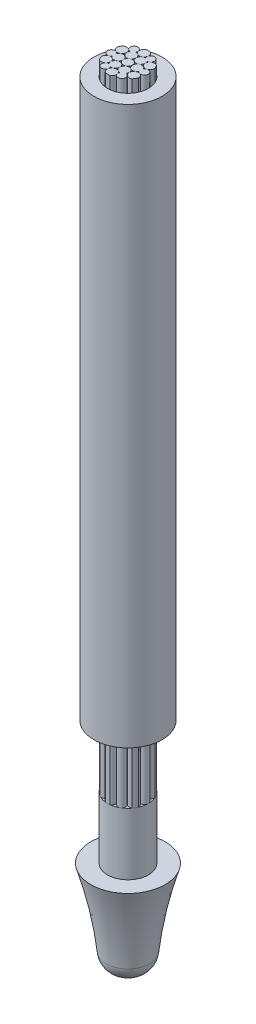
from build123d import *

# Parameters (mm, degrees)
EXTRUDE_2_OUTLINE_R = 0.075
EXTRUDE_2_DEPTH     = 10.2
EXTRUDE_2_2_DEPTH   = 10.2
EXTRUDE_2_3_DEPTH   = 10.2
EXTRUDE_2_4_DEPTH   = 10.2
EXTRUDE_2_5_DEPTH   = 10.2
EXTRUDE_2_6_DEPTH   = 10.2
EXTRUDE_2_7_DEPTH   = 10.2
EXTRUDE_2_8_DEPTH   = 10.2
EXTRUDE_2_9_DEPTH   = 10.2
EXTRUDE_2_10_DEPTH  = 10.2
EXTRUDE_2_11_DEPTH  = 10.2
EXTRUDE_2_12_DEPTH  = 10.2
EXTRUDE_2_13_DEPTH  = 10.2
EXTRUDE_5_DEPTH     = 2.5
EXTRUDE_START       = 1
SKETCH_3_R          = 0.55
SKETCH_3_R_2        = 0.33
EXTRUDE_6_DEPTH     = 9
FILLET_3_R          = 0.3


# Read off the part's stored shape, not the designer's step: Бобышка-Вытянуть2
with BuildPart() as part:
    # Бобышка-Вытянуть2 outline → Бобышка-Вытянуть2 (new body)
    with BuildSketch(Plane(origin=(0, 0, 0), x_dir=(1, 0, 0), z_dir=(0, 1, 0))):
        Circle(EXTRUDE_2_OUTLINE_R)
    extrude(amount=EXTRUDE_2_DEPTH)


with BuildPart() as body_2:
    # Extrude 2 2 outline → Extrude 2 2 (new body)
    with BuildSketch(Plane(origin=(0, 0, 0), x_dir=(1, 0, 0), z_dir=(0, 1, 0))):
        with BuildLine():
            ThreePointArc((-0.215577435, 0.031523255), (-0.329990207, -0.00229018), (-0.215577435, -0.036103616))
            ThreePointArc((-0.215577435, -0.036103616), (-0.135616584, -0.076152155), (-0.074161469, -0.011183762))
            ThreePointArc((-0.074161469, -0.011183762), (-0.074991098, -0.00115549), (-0.074470828, 0.008893581))
            ThreePointArc((-0.074470828, 0.008893581), (-0.136756085, 0.071763554), (-0.215577435, 0.031523255))
        make_face()
    extrude(amount=EXTRUDE_2_2_DEPTH)



with BuildPart() as body_3:
    # Extrude 2 3 outline → Extrude 2 3 (new body)
    with BuildSketch(Plane(origin=(0, 0, 0), x_dir=(1, 0, 0), z_dir=(0, 1, 0))):
        with BuildLine():
            ThreePointArc((-0.078416857, 0.202460861), (-0.164965898, 0.285808068), (-0.13605962, 0.169180796))
            ThreePointArc((-0.13605962, 0.169180796), (-0.132931564, 0.081694169), (-0.049012134, 0.056769805))
            ThreePointArc((-0.049012134, 0.056769805), (-0.03748264, 0.064961925), (-0.024620163, 0.070843825))
            ThreePointArc((-0.024620163, 0.070843825), (-0.004207657, 0.155990018), (-0.078416857, 0.202460861))
        make_face()
    extrude(amount=EXTRUDE_2_3_DEPTH)


with BuildPart() as body_4:
    # Extrude 2 4 outline → Extrude 2 4 (new body)
    with BuildSketch(Plane(origin=(0, 0, 0), x_dir=(1, 0, 0), z_dir=(0, 1, 0))):
        with BuildLine():
            ThreePointArc((0.139140572, 0.168657106), (0.167012389, 0.284614831), (0.080525962, 0.202498267))
            ThreePointArc((0.080525962, 0.202498267), (0.006248792, 0.154228257), (0.029790206, 0.068829817))
            ThreePointArc((0.029790206, 0.068829817), (0.038512817, 0.06435653), (0.046577497, 0.058783813))
            ThreePointArc((0.046577497, 0.058783813), (0.133726217, 0.079291783), (0.139140572, 0.168657106))
        make_face()
    extrude(amount=EXTRUDE_2_4_DEPTH)


with BuildPart() as body_5:
    # Extrude 2 5 outline → Extrude 2 5 (new body)
    with BuildSketch(Plane(origin=(0, 0, 0), x_dir=(1, 0, 0), z_dir=(0, 1, 0))):
        with BuildLine():
            ThreePointArc((0.217749972, -0.037195687), (0.329990231, -0.002290181), (0.217749972, 0.032615326))
            ThreePointArc((0.217749972, 0.032615326), (0.076367703, -0.00229018), (0.217749972, -0.037195687))
        make_face()
    extrude(amount=EXTRUDE_2_5_DEPTH)


with BuildPart() as body_6:
    # Extrude 2 6 outline → Extrude 2 6 (new body)
    with BuildSketch(Plane(origin=(0, 0, 0), x_dir=(1, 0, 0), z_dir=(0, 1, 0))):
        with BuildLine():
            ThreePointArc((0.078601287, -0.207160724), (0.164936529, -0.285825011), (0.140123873, -0.171692736))
            ThreePointArc((0.140123873, -0.171692736), (0.038908974, -0.067218275), (0.078601287, -0.207160724))
        make_face()
    extrude(amount=EXTRUDE_2_6_DEPTH)


with BuildPart() as body_7:
    # Extrude 2 7 outline → Extrude 2 7 (new body)
    with BuildSketch(Plane(origin=(0, 0, 0), x_dir=(1, 0, 0), z_dir=(0, 1, 0))):
        with BuildLine():
            ThreePointArc((-0.137069196, -0.172203487), (-0.162882691, -0.286998397), (-0.076471576, -0.207140228))
            ThreePointArc((-0.076471576, -0.207140228), (-0.036171958, -0.067219203), (-0.137069196, -0.172203487))
        make_face()
    extrude(amount=EXTRUDE_2_7_DEPTH)


with BuildPart() as body_8:
    # Extrude 2 8 outline → Extrude 2 8 (new body)
    with BuildSketch(Plane(origin=(0, 0, 0), x_dir=(1, 0, 0), z_dir=(0, 1, 0))):
        with BuildLine():
            ThreePointArc((-0.296729349, 0.144401155), (-0.158491958, 0.090441918), (-0.275270897, 0.182005311))
            ThreePointArc((-0.275270897, 0.182005311), (-0.286617495, 0.163555531), (-0.296729349, 0.144401155))
        make_face()
    extrude(amount=EXTRUDE_2_8_DEPTH)


with BuildPart() as body_9:
    # Extrude 2 9 outline → Extrude 2 9 (new body)
    with BuildSketch(Plane(origin=(0, 0, 0), x_dir=(1, 0, 0), z_dir=(0, 1, 0))):
        with BuildLine():
            ThreePointArc((-0.267830407, -0.192787118), (-0.159068831, -0.0940291), (-0.29802696, -0.141703673))
            ThreePointArc((-0.29802696, -0.141703673), (-0.284079249, -0.16792552), (-0.267830407, -0.192787118))
        make_face()
    extrude(amount=EXTRUDE_2_9_DEPTH)


with BuildPart() as body_10:
    # Extrude 2 10 outline → Extrude 2 10 (new body)
    with BuildSketch(Plane(origin=(0, 0, 0), x_dir=(1, 0, 0), z_dir=(0, 1, 0))):
        with BuildLine():
            ThreePointArc((-0.020066658, 0.329389328), (0.000969374, 0.182518498), (0.023564272, 0.329157599))
            ThreePointArc((0.023564272, 0.329157599), (0.001752641, 0.329995346), (-0.020066658, 0.329389328))
        make_face()
    extrude(amount=EXTRUDE_2_10_DEPTH)


with BuildPart() as body_11:
    # Extrude 2 11 outline → Extrude 2 11 (new body)
    with BuildSketch(Plane(origin=(0, 0, 0), x_dir=(1, 0, 0), z_dir=(0, 1, 0))):
        with BuildLine():
            ThreePointArc((0.038848965, -0.327705291), (0.000977296, -0.187743587), (-0.03543522, -0.328091977))
            ThreePointArc((-0.03543522, -0.328091977), (0.001717788, -0.329995529), (0.038848965, -0.327705291))
        make_face()
    extrude(amount=EXTRUDE_2_11_DEPTH)


with BuildPart() as body_12:
    # Extrude 2 12 outline → Extrude 2 12 (new body)
    with BuildSketch(Plane(origin=(0, 0, 0), x_dir=(1, 0, 0), z_dir=(0, 1, 0))):
        with BuildLine():
            ThreePointArc((0.301331175, -0.134534467), (0.161602494, -0.094372467), (0.265242363, -0.196332597))
            ThreePointArc((0.265242363, -0.196332597), (0.284966921, -0.166414705), (0.301331175, -0.134534467))
        make_face()
    extrude(amount=EXTRUDE_2_12_DEPTH)


with BuildPart() as body_13:
    # Extrude 2 13 outline → Extrude 2 13 (new body)
    with BuildSketch(Plane(origin=(0, 0, 0), x_dir=(1, 0, 0), z_dir=(0, 1, 0))):
        with BuildLine():
            ThreePointArc((0.271600665, 0.1874382), (0.16103432, 0.090782272), (0.300968191, 0.135344552))
            ThreePointArc((0.300968191, 0.135344552), (0.287466887, 0.162057981), (0.271600665, 0.1874382))
        make_face()
    extrude(amount=EXTRUDE_2_13_DEPTH)


with BuildPart() as body_14:
    # Эскиз2 → Бобышка-Вытянуть5 (new body)
    with BuildSketch(Plane(origin=(0, 0, 0), x_dir=(1, 0, 0), z_dir=(0, 1, 0))):
        with BuildLine():
            ThreePointArc((-0.020066658, 0.329389328), (-0.165035087, 0.285768123), (-0.275270897, 0.182005311))
            ThreePointArc((-0.275270897, 0.182005311), (-0.286617495, 0.163555531), (-0.296729349, 0.144401155))
            ThreePointArc((-0.296729349, 0.144401155), (-0.329996606, 0.00149668), (-0.29802696, -0.141703673))
            ThreePointArc((-0.29802696, -0.141703673), (-0.284079249, -0.16792552), (-0.267830407, -0.192787118))
            ThreePointArc((-0.267830407, -0.192787118), (-0.166040241, -0.285185271), (-0.03543522, -0.328091977))
            ThreePointArc((-0.03543522, -0.328091977), (0.001717788, -0.329995529), (0.038848965, -0.327705291))
            ThreePointArc((0.038848965, -0.327705291), (0.165627836, -0.285424981), (0.265242363, -0.196332597))
            ThreePointArc((0.265242363, -0.196332597), (0.284966921, -0.166414705), (0.301331175, -0.134534467))
            ThreePointArc((0.301331175, -0.134534467), (0.322753225, -0.068777584), (0.33, 0))
            ThreePointArc((0.33, 0), (0.322660428, 0.069211621), (0.300968191, 0.135344552))
            ThreePointArc((0.300968191, 0.135344552), (0.287466887, 0.162057981), (0.271600665, 0.1874382))
            ThreePointArc((0.271600665, 0.1874382), (0.163712193, 0.28652804), (0.023564272, 0.329157599))
            ThreePointArc((0.023564272, 0.329157599), (0.001752641, 0.329995346), (-0.020066658, 0.329389328))
        make_face()
    extrude(amount=-EXTRUDE_5_DEPTH)

    # Эскиз5 → Повернуть1 (revolve)
    with BuildSketch(Plane(origin=(0, 0, 0), x_dir=(-1, 0, 0), z_dir=(0, 0, 1)), mode=Mode.PRIVATE) as revolve_1_sk:
        with BuildLine():
            Line((-0.33, 1), (-0.6, 1))
            add(Edge.make_bspline(
                [(-0.33, 2.501807797), (-0.375572962, 1.732354596), (-0.6, 1)],
                knots=[0, 0, 0, 1, 1, 1], degree=2))
            Line((-0.33, 2.501807797), (0, 2.501807797))
            Line((0, 2.501807797), (0, 1))
            Line((0, 1), (-0.33, 1))
        make_face()
    revolve(revolve_1_sk.sketch.rotate(Axis((0, -1, 0), (0, -1, 0)), 90), axis=Axis((0, -1, 0), (0, -1, 0)))

    # Скругление3
    fillet_3_edges = [body_14.edges().sort_by_distance(p)[0] for p in [
        (0, -2.501807797, -0.33),
    ]]
    fillet(fillet_3_edges, radius=FILLET_3_R)


with BuildPart() as body_2_1:
    add(body_2.part)

    add(body_3.part)  # Бобышка-Вытянуть6 merges body 3

    add(body_4.part)  # Бобышка-Вытянуть6 merges body 4

    add(body_5.part)  # Бобышка-Вытянуть6 merges body 5

    add(body_6.part)  # Бобышка-Вытянуть6 merges body 6

    add(body_7.part)  # Бобышка-Вытянуть6 merges body 7

    add(body_8.part)  # Бобышка-Вытянуть6 merges body 8

    add(body_9.part)  # Бобышка-Вытянуть6 merges body 9

    add(body_10.part)  # Бобышка-Вытянуть6 merges body 10

    add(body_11.part)  # Бобышка-Вытянуть6 merges body 11

    add(body_12.part)  # Бобышка-Вытянуть6 merges body 12

    add(body_13.part)  # Бобышка-Вытянуть6 merges body 13
    # Эскиз3 → Бобышка-Вытянуть6 (add)
    with BuildSketch(Plane(origin=(0, 0, 0), x_dir=(1, 0, 0), z_dir=(0, 1, 0)).offset(EXTRUDE_START)):
        with Locations(Location((0, 0, 0), (0, 0, 270))):
            Circle(SKETCH_3_R)
        with Locations(Location((0, 0, 0), (0, 0, 270))):
            Circle(SKETCH_3_R_2, mode=Mode.SUBTRACT)
    extrude(amount=EXTRUDE_6_DEPTH)


solid = Compound([part.part, body_14.part, body_2_1.part])
